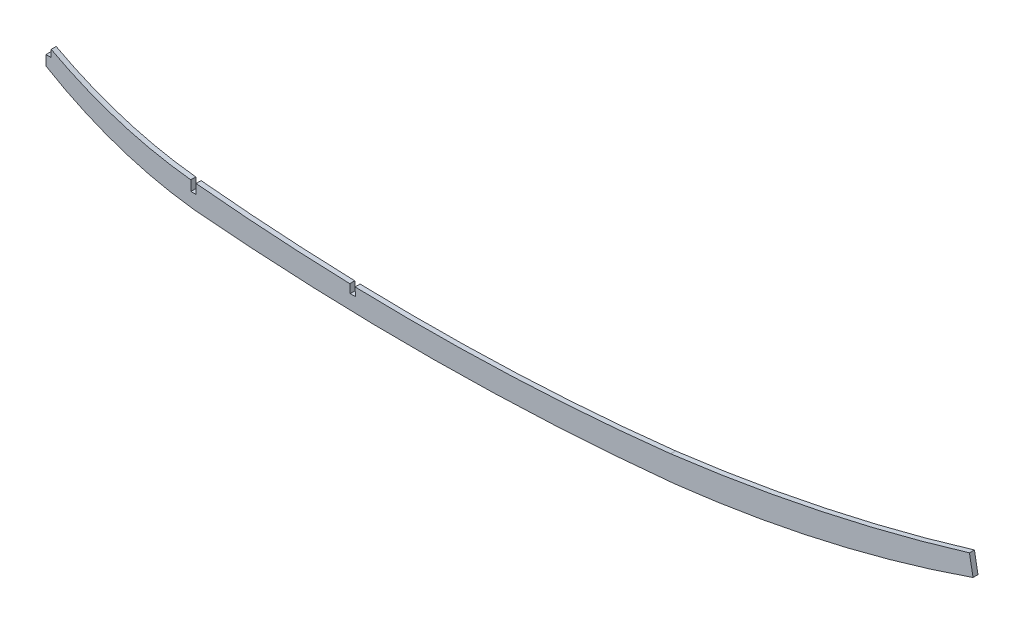
from build123d import *

# Parameters (mm, degrees)
BOSS_EXTRUDE1_DEPTH = 3.175
SKETCH3_W           = 3.3782
SKETCH3_H           = 9.116578424
CUT_EXTRUDE2_DEPTH  = 606.636541674


with BuildPart() as part:
    # Sketch2 → Boss-Extrude1 (new body)
    with BuildSketch(Plane.XY):
        with BuildLine():
            Line((0, -81.769447024), (0, -94.469447024))
            ThreePointArc((0, -94.469447024), (45.293757409, -115.460746442), (93.98, -126.497453101))
            ThreePointArc((93.98, -126.497453101), (247.132802315, -132.883361709), (400.203586987, -124.765753327))
            ThreePointArc((400.203586987, -124.765753327), (496.73811025, -108.348158667), (590.864339182, -81.353629169))
            Line((590.864339182, -81.353629169), (588.593285498, -68.858337449))
            ThreePointArc((588.593285498, -68.858337449), (494.24795915, -93.166461028), (398.184073829, -109.403930433))
            ThreePointArc((398.184073829, -109.403930433), (246.131127604, -118.387559898), (93.98, -111.257453101))
            ThreePointArc((93.98, -111.257453101), (45.478698707, -101.330055673), (0, -81.769447024))
        make_face()
    extrude(amount=BOSS_EXTRUDE1_DEPTH)

    # Sketch3 → Cut-Extrude2 (cut, through all)
    with BuildSketch(Plane.XY.offset(3.175)):
        Polygon((0, -81.823651503), (0, -88.097451503), (3.302, -88.097451503), (3.302, -81.823651503), (3.302, -80.849253243), (0, -80.849253243), align=None)
        with Locations((93.98, -112.972963904)):
            Rectangle(SKETCH3_W, SKETCH3_H)
        Polygon((183.426070396, 128.229599916), (183.158711139, 134.615096468), (186.330931782, 134.747916609), (186.598291039, 128.362420058), align=None)
        Polygon((193.849633474, -123.151114373), (197.224876239, -123.009793743), (196.926348208, -115.879875231), (193.551105443, -116.021195861), align=None)
    extrude(amount=-CUT_EXTRUDE2_DEPTH, mode=Mode.SUBTRACT)


solid = part.part
